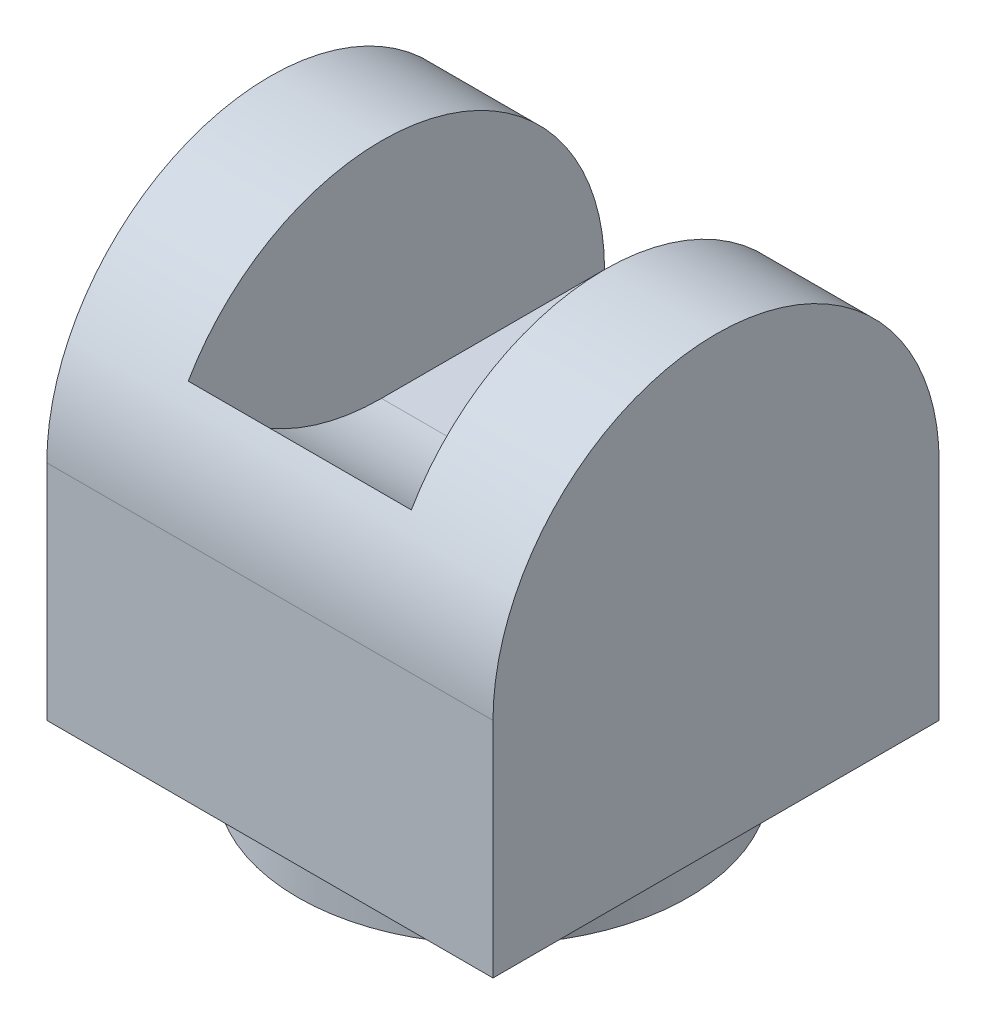
from build123d import *

# Parameters (mm, degrees)
SKETCH_1_R          = 7
EXTRUDE_1_DEPTH     = 2
SKETCH_2_W          = 16
SKETCH_2_H          = 16
EXTRUDE_2_DEPTH     = 16
CUT_EXTRUDE_2_DEPTH = 4
CUT_EXTRUDE_4_DEPTH = 26.377155081


with BuildPart() as part:
    # 草图1 → 凸台-拉伸1 (new body)
    with BuildSketch(Plane(origin=(0, 0, 0), x_dir=(1, 0, 0), z_dir=(0, 1, 0))):
        Circle(SKETCH_1_R)
    extrude(amount=EXTRUDE_1_DEPTH)

    # 草图2 → 凸台-拉伸2 (add)
    with BuildSketch(Plane(origin=(0, 2, 0), x_dir=(1, 0, 0), z_dir=(0, 1, 0))):
        Rectangle(SKETCH_2_W, SKETCH_2_H)
    extrude(amount=EXTRUDE_2_DEPTH)

    # 草图4 → 切除-拉伸2 (cut, symmetric)
    with BuildSketch(Plane(origin=(0, 0, 0), x_dir=(0, 0, -1), z_dir=(1, 0, 0))):
        with BuildLine():
            Line((8, 10), (8, 18))
            ThreePointArc((8, 18), (-5.656854249, 23.656854249), (0, 10))
            Line((0, 10), (8, 10))
        make_face()
    extrude(amount=CUT_EXTRUDE_2_DEPTH, both=True, mode=Mode.SUBTRACT)

    # 草图6 → 切除-拉伸4 (cut, through all)
    with BuildSketch(Plane(origin=(8, 0, 0), x_dir=(0, 0, -1), z_dir=(1, 0, 0))):
        with BuildLine():
            Line((-8, 10), (-8, 18.679937549))
            Line((-8, 18.679937549), (8, 18.679937549))
            Line((8, 18.679937549), (8, 10))
            ThreePointArc((8, 10), (0, 18), (-8, 10))
        make_face()
    extrude(amount=-CUT_EXTRUDE_4_DEPTH, mode=Mode.SUBTRACT)


solid = part.part
